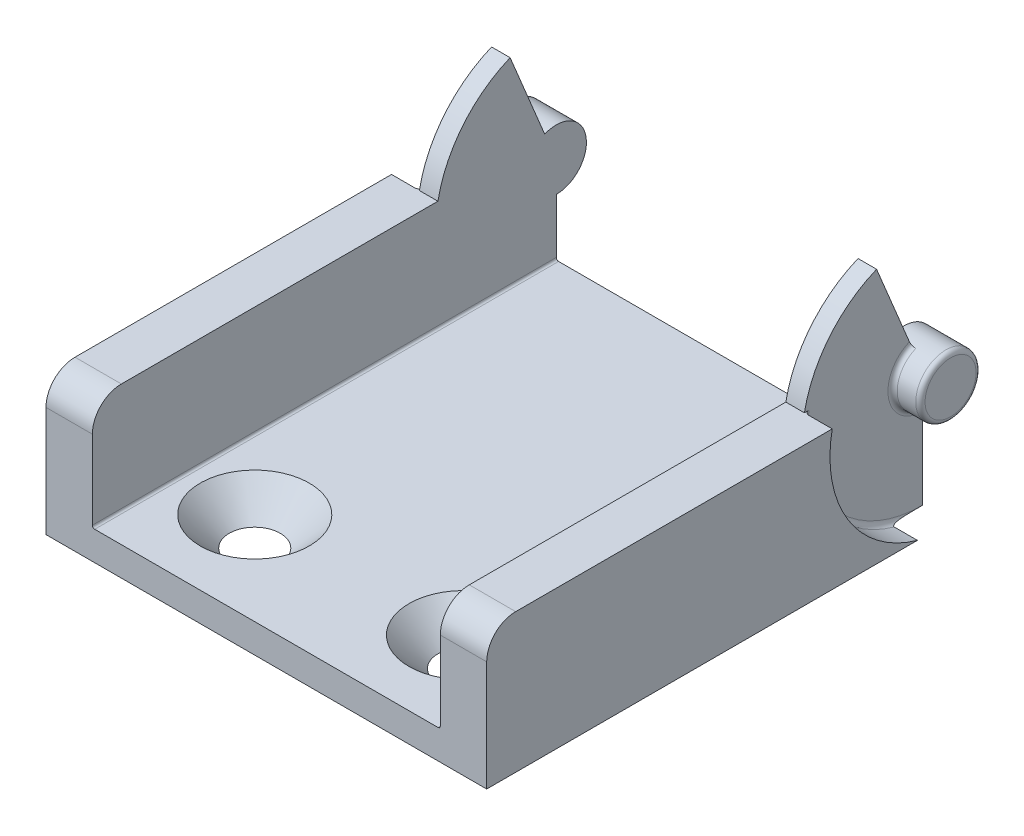
from build123d import *

# Parameters (mm, degrees)
BOSS_EXTRUDE5_START             = -19
BOSS_EXTRUDE5_DEPTH             = 38
CUT_EXTRUDE1_START              = -2.4
CUT_EXTRUDE1_DEPTH              = 2.4
BOSS_EXTRUDE4_REACH             = 47.398
SKETCH5_R                       = 2.6
BOSS_EXTRUDE4_DIRECTION_2_REACH = 47.398
CUT_EXTRUDE3_DEPTH              = 48.70492637
CUT_EXTRUDE3_DEPTH_BACK         = 48.70492637
FILLET17_R                      = 0.4
FILLET_1_R                      = 2.5
HOLE_WIZARD_M41_D               = 4.2
HOLE_WIZARD_M41_DEPTH           = 8.5
HOLE_WIZARD_M41_CSINK_D         = 9.4
HOLE_WIZARD_M41_CSINK_ANGLE     = 90
HOLE_WIZARD_M41_TIP             = 1.2618073


# Read off the part's stored shape, not the designer's step: Boss-Extrude5
with BuildPart() as part:
    # Boss-Extrude5 outline → Boss-Extrude5 (new body)
    with BuildSketch(Plane(origin=(0, 0, 0), x_dir=(0, 0, -1), z_dir=(1, 0, 0)).offset(BOSS_EXTRUDE5_START)):
        with BuildLine():
            Line((0, -10), (40, -10))
            Line((40, -10), (40, 0))
            Line((40, 0), (36.020092303, 9.608347138))
            ThreePointArc((36.020092303, 9.608347138), (31.951342699, 6.586282384), (29.794119342, 2))
            Line((29.794119342, 2), (0, 2))
            Line((0, 2), (0, -10))
        make_face()
    extrude(amount=BOSS_EXTRUDE5_DEPTH)

    # Sketch4 → Cut-Extrude1 (cut)
    with BuildSketch(Plane(origin=(19, 0, 0), x_dir=(0, 0, -1), z_dir=(1, 0, 0)).offset(CUT_EXTRUDE1_START)):
        with BuildLine():
            Line((32.646089476, 7.353910524), (50.4, 25.107821049))
            Line((50.4, 25.107821049), (50.4, 0))
            ThreePointArc((50.4, 0), (36.020092303, -9.608347138), (32.646089476, 7.353910524))
        make_face()
    cut_extrude1 = extrude(amount=CUT_EXTRUDE1_DEPTH, mode=Mode.SUBTRACT)

    # Mirror1: Cut-Extrude1 across plane
    add(cut_extrude1.mirror(Plane(origin=(0, 0, 0), x_dir=(0, 0, 1), z_dir=(1, 0, 0))), mode=Mode.SUBTRACT)

    # Boss-Extrude4: up to this face of the body (flat: up to its plane)
    boss_extrude4_end = Plane(part.part.faces().sort_by_distance((19, -4.194169539, -15.691958581))[0])
    # Sketch5 → Boss-Extrude4 (add, up to the picked face)
    with BuildSketch(Plane(origin=(0, 0, 0), x_dir=(0, 0, -1), z_dir=(1, 0, 0)), mode=Mode.PRIVATE) as boss_extrude4_sk1:
        with Locations((40, 0)):
            Circle(SKETCH5_R)
    boss_extrude4_tool1 = split(extrude(boss_extrude4_sk1.sketch, amount=BOSS_EXTRUDE4_REACH, mode=Mode.PRIVATE), bisect_by=boss_extrude4_end, keep=Keep.BOTH, mode=Mode.PRIVATE)
    add(boss_extrude4_tool1.solids().sort_by(Axis((0, 0, -40), (1, 0, 0)))[0])

    # Boss-Extrude4 direction 2: up to this face of the body (flat: up to its plane)
    boss_extrude4_direction_2_end = Plane(part.part.faces().sort_by_distance((-19, -4.194169539, -15.691958581))[0])
    # Sketch5 → Boss-Extrude4 direction 2 (add, up to the picked face)
    with BuildSketch(Plane(origin=(0, 0, 0), x_dir=(0, 0, -1), z_dir=(1, 0, 0)), mode=Mode.PRIVATE) as boss_extrude4_direction_2_sk1:
        with Locations((40, 0)):
            Circle(SKETCH5_R)
    boss_extrude4_direction_2_tool1 = split(extrude(boss_extrude4_direction_2_sk1.sketch, amount=-BOSS_EXTRUDE4_DIRECTION_2_REACH, mode=Mode.PRIVATE), bisect_by=boss_extrude4_direction_2_end, keep=Keep.BOTH, mode=Mode.PRIVATE)
    add(boss_extrude4_direction_2_tool1.solids().sort_by(Axis((0, 0, -40), (-1, 0, 0)))[0])

    # Sketch7 → Cut-Extrude3 (cut, two sides: drawn at the far end of the back side and taken through both)
    with BuildSketch(Plane.XY.offset(-CUT_EXTRUDE3_DEPTH_BACK)):
        with BuildLine():
            Line((-14.8, -7.5), (14.8, -7.5))
            ThreePointArc((14.8, -7.5), (14.941421356, -7.441421356), (15, -7.3))
            Line((15, -7.3), (15, 12.3))
            ThreePointArc((15, 12.3), (14.941421356, 12.441421356), (14.8, 12.5))
            Line((14.8, 12.5), (-14.8, 12.5))
            ThreePointArc((-14.8, 12.5), (-14.941421356, 12.441421356), (-15, 12.3))
            Line((-15, 12.3), (-15, -7.3))
            ThreePointArc((-15, -7.3), (-14.941421356, -7.441421356), (-14.8, -7.5))
        make_face()
    extrude(amount=CUT_EXTRUDE3_DEPTH + CUT_EXTRUDE3_DEPTH_BACK, mode=Mode.SUBTRACT)

    # Fillet17
    fillet17_edges = [part.edges().sort_by_distance(p)[0] for p in [
        (-19, 0, -37.4),
        (19, 0, -37.4),
        (-16.6, -0.507234837, -37.449958271),
        (16.6, -0.507234837, -37.449958271),
        (16.6, -5.431674396, -31.13112672),
        (-16.6, -5.431674396, -31.13112672),
    ]]
    fillet(fillet17_edges, radius=FILLET17_R)

    # Скругление1
    fillet_1_edges = [part.edges().sort_by_distance(p)[0] for p in [
        (17, 2, 0),
        (-17, 2, 0),
    ]]
    fillet(fillet_1_edges, radius=FILLET_1_R)

    # Зенковка для винта с полупотайной головкой M41
    with Locations(Plane(origin=(-9, -7.5, -8), x_dir=(0, 0, 1), z_dir=(0, 1, 0))):
        with Locations((0, 0), (0, 18)):
            CounterSinkHole(HOLE_WIZARD_M41_D / 2, HOLE_WIZARD_M41_CSINK_D / 2, depth=HOLE_WIZARD_M41_DEPTH, counter_sink_angle=HOLE_WIZARD_M41_CSINK_ANGLE)
            with Locations((0, 0, -(HOLE_WIZARD_M41_DEPTH + HOLE_WIZARD_M41_TIP / 2))):  # 118° drill point
                Cone(0, HOLE_WIZARD_M41_D / 2, HOLE_WIZARD_M41_TIP, mode=Mode.SUBTRACT)


solid = part.part
